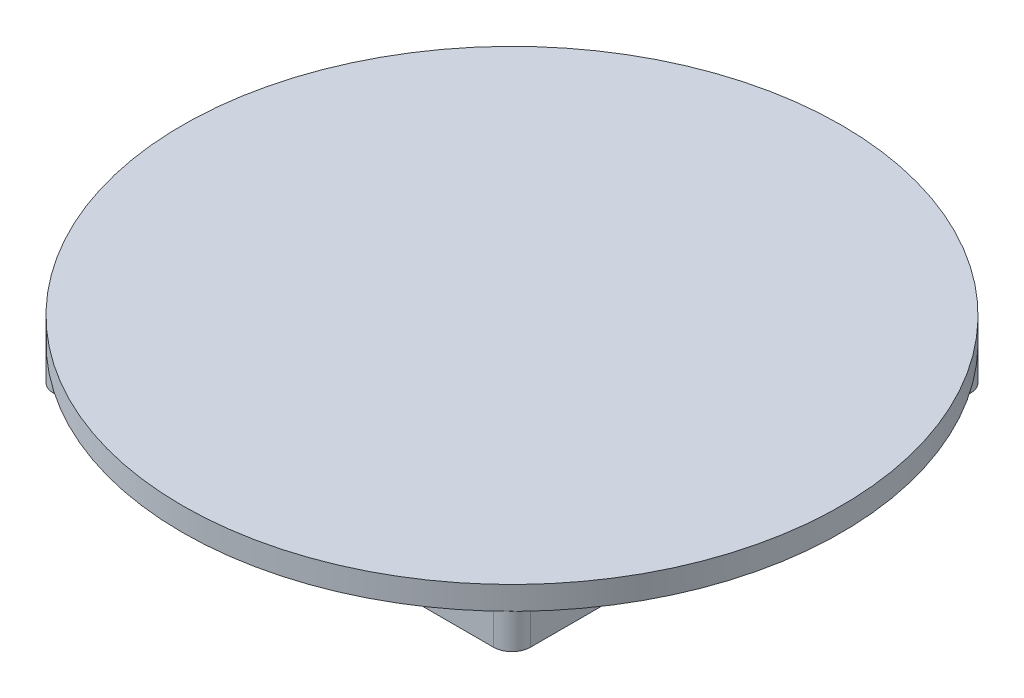
from build123d import *

# Parameters (mm, degrees)
BOSS_EXTRUDE1_DEPTH = 7.5
SKETCH4_R           = 70.821590822
BOSS_EXTRUDE3_DEPTH = 5


with BuildPart() as part:
    # Sketch1 → Boss-Extrude1 (new body)
    with BuildSketch(Plane(origin=(0, 0, 0), x_dir=(1, 0, 0), z_dir=(0, 1, 0))):
        with BuildLine():
            ThreePointArc((-42.003937008, 34.906496063), (-44.832364133, 33.734923188), (-46.003937008, 30.906496063))
            Line((-46.003937008, 30.906496063), (-46.003937008, -63.593503937))
            ThreePointArc((-46.003937008, -63.593503937), (-44.832364133, -66.421931062), (-42.003937008, -67.593503937))
            Line((-42.003937008, -67.593503937), (52.496062992, -67.593503937))
            ThreePointArc((52.496062992, -67.593503937), (55.324490117, -66.421931062), (56.496062992, -63.593503937))
            Line((56.496062992, -63.593503937), (56.496062992, 30.906496063))
            ThreePointArc((56.496062992, 30.906496063), (55.324490117, 33.734923188), (52.496062992, 34.906496063))
            Line((52.496062992, 34.906496063), (-42.003937008, 34.906496063))
        make_face()
        with BuildLine():
            ThreePointArc((-40.947455256, -62.537022185), (-40.947455256, -59.850016416), (-38.260449487, -59.850016416))
            ThreePointArc((-38.260449487, -59.850016416), (-37.84858126, -60.466420779), (-37.703952372, -61.193519301))
            ThreePointArc((-37.703952372, -61.193519301), (-38.87685385, -62.948890412), (-40.947455256, -62.537022185))
        make_face(mode=Mode.SUBTRACT)
        with BuildLine():
            ThreePointArc((-33.056143578, -54.645710507), (-33.056143578, -53.090075588), (-31.500508659, -53.090075588))
            ThreePointArc((-31.500508659, -53.090075588), (-31.262058633, -53.446941272), (-31.178326118, -53.867893048))
            ThreePointArc((-31.178326118, -53.867893048), (-31.857374343, -54.884160533), (-33.056143578, -54.645710507))
        make_face(mode=Mode.SUBTRACT)
        with BuildLine():
            ThreePointArc((51.996078356, -61.193519301), (51.851449468, -61.920617822), (51.43958124, -62.537022185))
            ThreePointArc((51.43958124, -62.537022185), (48.752575472, -62.537022185), (48.752575472, -59.850016416))
            ThreePointArc((48.752575472, -59.850016416), (50.823176877, -59.438148189), (51.996078356, -61.193519301))
        make_face(mode=Mode.SUBTRACT)
        with BuildLine():
            ThreePointArc((43.870452103, -53.867893048), (43.786719589, -54.288844823), (43.548269562, -54.645710507))
            ThreePointArc((43.548269562, -54.645710507), (41.992634643, -54.645710507), (41.992634643, -53.090075588))
            ThreePointArc((41.992634643, -53.090075588), (43.191403878, -52.851625562), (43.870452103, -53.867893048))
        make_face(mode=Mode.SUBTRACT)
        with BuildLine():
            ThreePointArc((32.646062992, -16.343503937), (30.560362183, -26.829029984), (24.620788797, -35.718229742))
            ThreePointArc((24.620788797, -35.718229742), (5.246062992, -43.743503937), (-14.128662812, -35.718229742))
            ThreePointArc((-14.128662812, -35.718229742), (-22.153937008, -16.343503937), (-14.128662812, 3.031221868))
            ThreePointArc((-14.128662812, 3.031221868), (5.246062992, 11.056496063), (24.620788797, 3.031221868))
            ThreePointArc((24.620788797, 3.031221868), (30.560362183, -5.85797789), (32.646062992, -16.343503937))
        make_face(mode=Mode.SUBTRACT)
        with BuildLine():
            ThreePointArc((-31.178326118, 21.180885174), (-31.262058633, 20.759933398), (-31.500508659, 20.403067714))
            ThreePointArc((-31.500508659, 20.403067714), (-33.056143578, 20.403067714), (-33.056143578, 21.958702633))
            ThreePointArc((-33.056143578, 21.958702633), (-31.857374343, 22.197152659), (-31.178326118, 21.180885174))
        make_face(mode=Mode.SUBTRACT)
        with BuildLine():
            ThreePointArc((-37.703952372, 28.506511427), (-37.84858126, 27.779412905), (-38.260449487, 27.163008542))
            ThreePointArc((-38.260449487, 27.163008542), (-40.947455256, 27.163008542), (-40.947455256, 29.850014311))
            ThreePointArc((-40.947455256, 29.850014311), (-38.87685385, 30.261882538), (-37.703952372, 28.506511427))
        make_face(mode=Mode.SUBTRACT)
        with BuildLine():
            ThreePointArc((43.870452103, 21.180885174), (43.191403878, 20.164617688), (41.992634643, 20.403067714))
            ThreePointArc((41.992634643, 20.403067714), (41.992634643, 21.958702633), (43.548269562, 21.958702633))
            ThreePointArc((43.548269562, 21.958702633), (43.786719589, 21.601836949), (43.870452103, 21.180885174))
        make_face(mode=Mode.SUBTRACT)
        with BuildLine():
            ThreePointArc((51.996078356, 28.506511427), (50.823176877, 26.751140315), (48.752575472, 27.163008542))
            ThreePointArc((48.752575472, 27.163008542), (48.752575472, 29.850014311), (51.43958124, 29.850014311))
            ThreePointArc((51.43958124, 29.850014311), (51.851449468, 29.233609948), (51.996078356, 28.506511427))
        make_face(mode=Mode.SUBTRACT)
    extrude(amount=BOSS_EXTRUDE1_DEPTH)


with BuildPart() as body_2:
    # Sketch4 → Boss-Extrude3 (new body)
    with BuildSketch(Plane(origin=(0, 7.5, 0), x_dir=(1, 0, 0), z_dir=(0, 1, 0))):
        with Locations((5.246062992, -16.343503937)):
            Circle(SKETCH4_R)
    extrude(amount=BOSS_EXTRUDE3_DEPTH)


solid = Compound([part.part, body_2.part])
